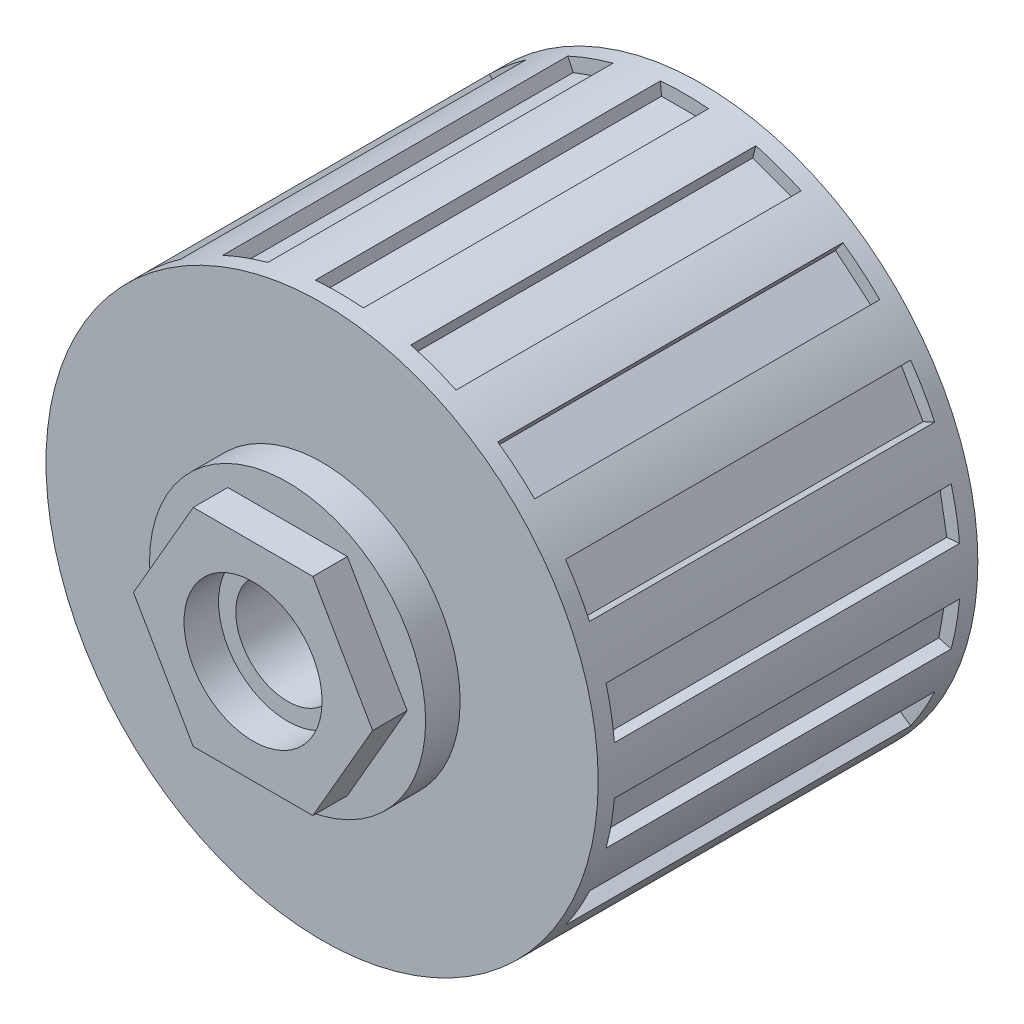
from build123d import *

# Parameters (mm, degrees)
SKETCH_1_R               = 80
SKETCH_1_R_2             = 15
EXTRUDE_1_DEPTH          = 120
CUT_EXTRUDE_START        = -100
CUT_EXTRUDE_1_DEPTH      = 100
PATTERN_CIRCULAR_1_COUNT = 18
SKETCH_3_R               = 50
SKETCH_3_R_2             = 20
EXTRUDE_2_DEPTH          = 3
SKETCH_4_R               = 20
EXTRUDE_3_DEPTH          = 10
SKETCH_5_OUTSIDE_W       = 214.192
SKETCH_5_OUTSIDE_H       = 214.192
SKETCH_5_OUTSIDE_R       = 40
CUT_EXTRUDE_2_DEPTH      = 10


with BuildPart() as part:
    # 草图1 → 凸台-拉伸1 (new body)
    with BuildSketch(Plane.XY):
        Circle(SKETCH_1_R)
        Circle(SKETCH_1_R_2, mode=Mode.SUBTRACT)
    extrude(amount=EXTRUDE_1_DEPTH)

    # 草图2 → 切除-拉伸1 (cut)
    with BuildSketch(Plane.XY.offset(105).offset(CUT_EXTRUDE_START)):
        with BuildLine():
            Line((-6.649138428, 76), (-6.97245942, 79.695575847))
            ThreePointArc((-6.97245942, 79.695575847), (0, 80), (6.97245942, 79.695575847))
            Line((6.97245942, 79.695575847), (6.649138428, 76))
            Line((6.649138428, 76), (-6.649138428, 76))
        make_face()
    cut_extrude_1 = extrude(amount=CUT_EXTRUDE_1_DEPTH, mode=Mode.SUBTRACT)

    # 阵列(圆周)1: 切除-拉伸1 ×18 about axis
    pattern_circular_1_axis = Axis((0, 0, 120), (0, 0, -1))
    for i in range(1, PATTERN_CIRCULAR_1_COUNT):
        add(cut_extrude_1.rotate(pattern_circular_1_axis, i * 360 / PATTERN_CIRCULAR_1_COUNT), mode=Mode.SUBTRACT)

    # 草图3 → 凸台-拉伸2 (add)
    with BuildSketch(Plane.XY.offset(120)):
        Circle(SKETCH_3_R)
        Circle(SKETCH_3_R_2, mode=Mode.SUBTRACT)
    extrude(amount=-EXTRUDE_2_DEPTH)

    # 草图4 → 凸台-拉伸3 (add)
    with BuildSketch(Plane.XY.offset(120)):
        Polygon((34.641016151, 0), (17.320508076, 30), (-17.320508076, 30), (-34.641016151, 0), (-17.320508076, -30), (17.320508076, -30), align=None)
        Circle(SKETCH_4_R, mode=Mode.SUBTRACT)
    extrude(amount=EXTRUDE_3_DEPTH)

    # 草图5 outside → 切除-拉伸2 (cut)
    with BuildSketch(Plane.XY.offset(120)):
        Rectangle(SKETCH_5_OUTSIDE_W, SKETCH_5_OUTSIDE_H)
        Circle(SKETCH_5_OUTSIDE_R, mode=Mode.SUBTRACT)
    extrude(amount=-CUT_EXTRUDE_2_DEPTH, mode=Mode.SUBTRACT)


solid = part.part
